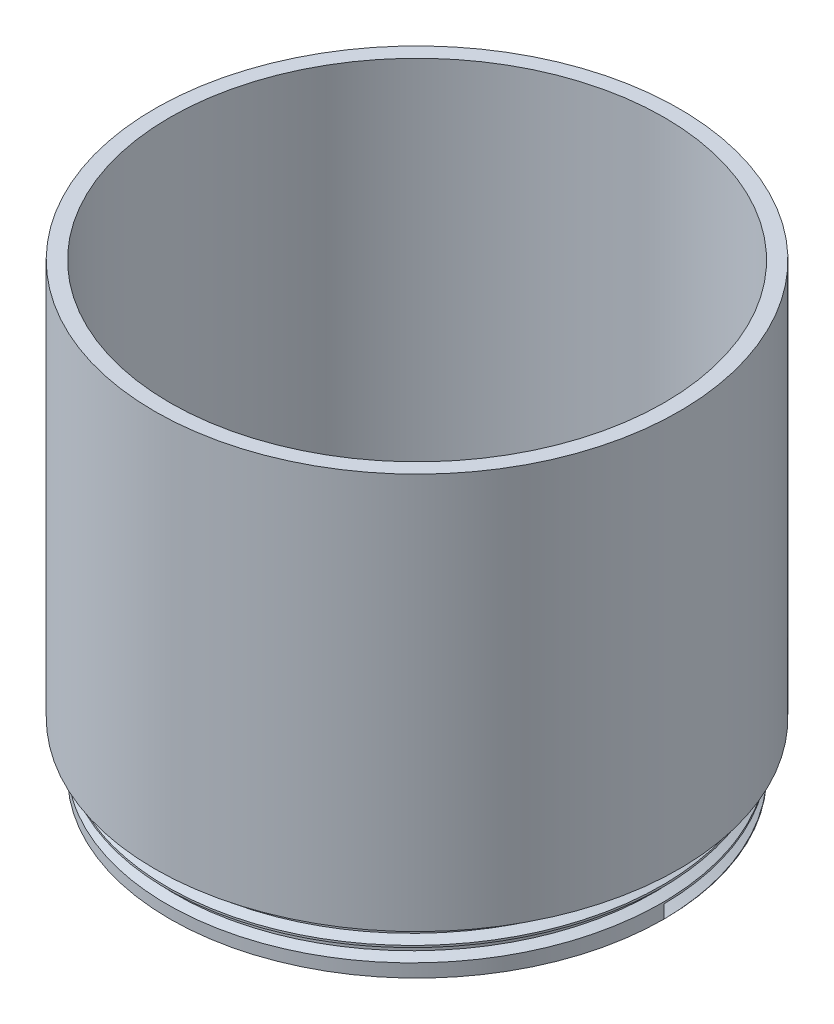
from build123d import *
from build123d.topology import SkipClean

# Parameters (mm, degrees)
SKETCH1_R           = 32.75
SKETCH1_R_2         = 30.25
BOSS_EXTRUDE1_DEPTH = 6.75
SKETCH2_R           = 34.75
SKETCH2_R_2         = 30.25
BOSS_EXTRUDE2_DEPTH = 2.5
THREAD1_PITCH       = 2
BOSS_EXTRUDE3_DEPTH = 2
SKETCH5_R           = 34.75
SKETCH5_R_2         = 32.75
BOSS_EXTRUDE4_DEPTH = 50


with BuildPart() as part:
    # Sketch1 → Boss-Extrude1 (new body)
    with BuildSketch(Plane(origin=(0, 0, 0), x_dir=(1, 0, 0), z_dir=(0, 1, 0))):
        with Locations(Location((0, 0, 0), (0, 0, 270))):
            Circle(SKETCH1_R)
        with Locations(Location((0, 0, 0), (0, 0, 270))):
            Circle(SKETCH1_R_2, mode=Mode.SUBTRACT)
    extrude(amount=BOSS_EXTRUDE1_DEPTH)

    # Sketch2 → Boss-Extrude2 (add)
    with BuildSketch(Plane(origin=(0, 6.75, 0), x_dir=(1, 0, 0), z_dir=(0, 1, 0))):
        with Locations(Location((0, 0, 0), (0, 0, 270))):
            Circle(SKETCH2_R)
        with Locations(Location((0, 0, 0), (0, 0, 270))):
            Circle(SKETCH2_R_2, mode=Mode.SUBTRACT)
    extrude(amount=BOSS_EXTRUDE2_DEPTH)

    # Thread1: the profile of Thread Profile1 profile screwed along a right-hand helix of 2.5 turns, 10 arcs to a turn; built about Z, then put on its axis
    with SkipClean():  # the faces are left unmerged after this step: merging them gives an invalid solid
        thread1_z = Axis((0, 0, 0), (0, 0, 1))
        thread1_corners = [(32.7503, 0, -0.000173205), (32.7503, 0, 1.7501732), (31.66746825, 0, 1.124999997), (31.66746825, 0, 0.624999997)]
        with BuildLine(mode=Mode.PRIVATE) as thread1_profile:
            Line(thread1_corners[0], thread1_corners[1])
            Line(thread1_corners[1], thread1_corners[2])
            Line(thread1_corners[2], thread1_corners[3])
            Line(thread1_corners[3], thread1_corners[0])
        thread1_cap = Face(thread1_profile.wire())
        thread1_turn_angles = [0, 18, 36, 54, 72, 90, 108, 126, 144, 162, 180, 198, 216, 234, 252, 270, 288, 306, 324, 342, 360]
        thread1_turn_weights = [1, 0.9510565162951535, 1, 0.9510565162951535, 1, 0.9510565162951535, 1, 0.9510565162951535, 1, 0.9510565162951535, 1, 0.9510565162951535, 1, 0.9510565162951535, 1, 0.9510565162951535, 1, 0.9510565162951535, 1, 0.9510565162951535, 1]
        thread1_turn_rails = [Edge.make_bspline([Vector(p[0], p[1], 0).rotate(thread1_z, thread1_turn_angles[k]) / thread1_turn_weights[k] + Vector(0, 0, p[2] + THREAD1_PITCH * thread1_turn_angles[k] / 360) for k in range(21)], [0, 0, 0, 1, 1, 2, 2, 3, 3, 4, 4, 5, 5, 6, 6, 7, 7, 8, 8, 9, 9, 10, 10, 10], 2, thread1_turn_weights) for p in thread1_corners]
        thread1_turn_sides = [Face.make_surface_from_curves(thread1_turn_rails[p[0]], thread1_turn_rails[p[1]]) for p in [(0, 1), (1, 2), (2, 3), (3, 0)]]
        thread1_last_angles = [720, 738, 756, 774, 792, 810, 828, 846, 864, 882, 900]
        thread1_last_weights = [1, 0.9510565162951535, 1, 0.9510565162951535, 1, 0.9510565162951535, 1, 0.9510565162951535, 1, 0.9510565162951535, 1]
        thread1_last_rails = [Edge.make_bspline([Vector(p[0], p[1], 0).rotate(thread1_z, thread1_last_angles[k]) / thread1_last_weights[k] + Vector(0, 0, p[2] + THREAD1_PITCH * thread1_last_angles[k] / 360) for k in range(11)], [0, 0, 0, 1, 1, 2, 2, 3, 3, 4, 4, 5, 5, 5], 2, thread1_last_weights) for p in thread1_corners]
        thread1_last_sides = [Face.make_surface_from_curves(thread1_last_rails[p[0]], thread1_last_rails[p[1]]) for p in [(0, 1), (1, 2), (2, 3), (3, 0)]]
        thread1 = Plane(origin=(0, 0, 0), x_dir=(1, 0, 0), z_dir=(0, 1, 0)) * Solid(Shell([*[p.moved(Location((0, 0, THREAD1_PITCH * i))) for i in range(2) for p in thread1_turn_sides], *thread1_last_sides, thread1_cap, thread1_cap.rotate(thread1_z, 900).moved(Location((0, 0, THREAD1_PITCH * 900 / 360)))]))
        add(thread1, mode=Mode.SUBTRACT)

    # Sketch3 → Boss-Extrude3 (add)
    with SkipClean():  # the faces are left unmerged after this step: merging them gives an invalid solid
        with BuildSketch(Plane.XZ):
            with BuildLine():
                Line((19.268659787, 19.268659787), (21.389980131, 21.389980131))
                ThreePointArc((21.389980131, 21.389980131), (30.25, 0), (21.389980131, -21.389980131))
                Line((21.389980131, -21.389980131), (19.268659787, -19.268659787))
                ThreePointArc((19.268659787, -19.268659787), (27.25, 0), (19.268659787, 19.268659787))
            make_face()
            with BuildLine():
                Line((-19.268659787, 19.268659787), (-21.389980131, 21.389980131))
                ThreePointArc((-21.389980131, 21.389980131), (-30.25, 0), (-21.389980131, -21.389980131))
                Line((-21.389980131, -21.389980131), (-19.268659787, -19.268659787))
                ThreePointArc((-19.268659787, -19.268659787), (-27.25, 0), (-19.268659787, 19.268659787))
            make_face()
        extrude(amount=-BOSS_EXTRUDE3_DEPTH)

    # Sketch5 → Boss-Extrude4 (add)
    with SkipClean():  # the faces are left unmerged after this step: merging them gives an invalid solid
        with BuildSketch(Plane(origin=(0, 9.25, 0), x_dir=(1, 0, 0), z_dir=(0, 1, 0))):
            with Locations(Location((0, 0, 0), (0, 0, 270))):
                Circle(SKETCH5_R)
            with Locations(Location((0, 0, 0), (0, 0, 270))):
                Circle(SKETCH5_R_2, mode=Mode.SUBTRACT)
        extrude(amount=BOSS_EXTRUDE4_DEPTH)


solid = part.part
